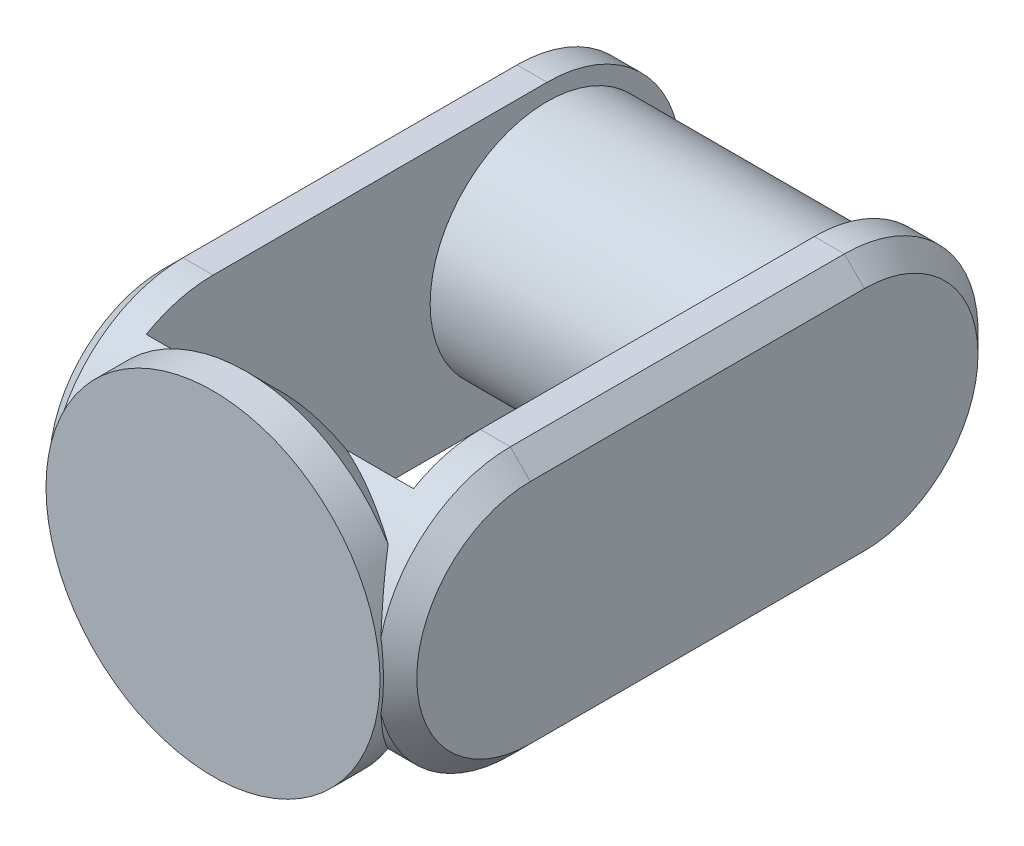
from build123d import *

# Parameters (mm, degrees)
SKETCH1_R           = 25
BOSS_EXTRUDE1_DEPTH = 10
BOSS_EXTRUDE3_DEPTH = 27.5
SKETCH7_W           = 40
SKETCH7_H           = 96.533506044
CUT_EXTRUDE3_DEPTH  = 55
CHAMFER1_SIZE       = 3
SKETCH8_R           = 17.5
BOSS_EXTRUDE4_DEPTH = 40
CHAMFER2_SIZE       = 5


with BuildPart() as part:
    # Sketch1 → Boss-Extrude1 (new body)
    with BuildSketch(Plane.XY):
        Circle(SKETCH1_R)
    extrude(amount=BOSS_EXTRUDE1_DEPTH)

    # Sketch6 → Boss-Extrude3 (add, symmetric)
    with BuildSketch(Plane(origin=(0, 0, 0), x_dir=(0, 0, -1), z_dir=(1, 0, 0))):
        with BuildLine():
            Line((10, 20), (60, 20))
            ThreePointArc((60, 20), (80, 0), (60, -20))
            Line((60, -20), (10, -20))
            ThreePointArc((10, -20), (-10, 0), (10, 20))
        make_face()
    extrude(amount=BOSS_EXTRUDE3_DEPTH, both=True)

    # Sketch7 → Cut-Extrude3 (cut)
    with BuildSketch(Plane(origin=(0, 20, 0), x_dir=(1, 0, 0), z_dir=(0, 1, 0))):
        with Locations((0, 48.266753022)):
            Rectangle(SKETCH7_W, SKETCH7_H)
    extrude(amount=-CUT_EXTRUDE3_DEPTH, mode=Mode.SUBTRACT)

    # Chamfer1
    # the kernel refuses this chamfer: 3 mm, written as the material it takes off along each edge
    with BuildSketch(Plane(origin=(-27.5, -20, -60), x_dir=(0.9996219169112965, -0.02749587661058676, 0), z_dir=(0, 0, 1)), Plane(origin=(27.5, -20, -60), x_dir=(0.027495876610586768, 0.9996219169112968, 0), z_dir=(0, 0, 1)), Plane(origin=(27.5, 20, -10), x_dir=(0.027495876610586768, -0.9996219169112968, 0), z_dir=(0, 0, -1))) as chamfer1_piece_1:
        Polygon((CHAMFER1_SIZE * 0.999621916911, CHAMFER1_SIZE * 0.0274958766106), (-CHAMFER1_SIZE * 0.0274958766106, CHAMFER1_SIZE * 0.999621916911), (0, 0), align=None)
    extrude(amount=50, mode=Mode.SUBTRACT)
    with BuildSketch(Plane(origin=(-27.5, 0, -60), x_dir=(0, 1, 0), z_dir=(0, 0, 1))) as chamfer1_piece_2:
        Polygon((20 - CHAMFER1_SIZE, 0), (20, -CHAMFER1_SIZE), (20, 0), align=None)
    revolve(axis=Axis((-27.5, 0, -60), (-1, 0, 0)), revolution_arc=180, mode=Mode.SUBTRACT)
    with BuildSketch(Plane(origin=(-27.5, 0, -10), x_dir=(0, -1, 0), z_dir=(0, 0, -1))) as chamfer1_piece_3_section:
        Polygon((20 - CHAMFER1_SIZE, 0), (20, -CHAMFER1_SIZE), (20, 0), align=None)
    chamfer1_piece_3 = revolve(axis=Axis((-27.5, 0, -10), (-1, 0, 0)), revolution_arc=180, mode=Mode.PRIVATE)
    chamfer1_piece_3 = chamfer1_piece_3 - Plane(origin=(0, 0, 8.545585815), x_dir=(1, 0, 0), z_dir=(0, 0, -1)) * Cylinder(25, 81, mode=Mode.PRIVATE)
    add(chamfer1_piece_3, mode=Mode.SUBTRACT)
    with BuildSketch(Plane(origin=(-27.5, 20, -10), x_dir=(-0.027495876610586768, -0.9996219169112968, 0), z_dir=(0, 0, -1))) as chamfer1_piece_4:
        Polygon((CHAMFER1_SIZE * 0.999621916911, -CHAMFER1_SIZE * 0.0274958766106), (-CHAMFER1_SIZE * 0.0274958766106, -CHAMFER1_SIZE * 0.999621916911), (0, 0), align=None)
    extrude(amount=50, mode=Mode.SUBTRACT)
    with BuildSketch(Plane(origin=(27.5, 0, -60), x_dir=(0, 1, 0), z_dir=(0, 0, 1))) as chamfer1_piece_5:
        Polygon((20, CHAMFER1_SIZE), (20 - CHAMFER1_SIZE, 0), (20, 0), align=None)
    revolve(axis=Axis((27.5, 0, -60), (-1, 0, 0)), revolution_arc=180, mode=Mode.SUBTRACT)
    with BuildSketch(Plane(origin=(27.5, 0, -10), x_dir=(0, -1, 0), z_dir=(0, 0, -1))) as chamfer1_piece_6_section:
        Polygon((20 - CHAMFER1_SIZE, 0), (20, CHAMFER1_SIZE), (20, 0), align=None)
    chamfer1_piece_6 = revolve(axis=Axis((27.5, 0, -10), (-1, 0, 0)), revolution_arc=180, mode=Mode.PRIVATE)
    chamfer1_piece_6 = chamfer1_piece_6 - Plane(origin=(0, 0, 8.545585813), x_dir=(1, 0, 0), z_dir=(0, 0, -1)) * Cylinder(25, 81, mode=Mode.PRIVATE)
    add(chamfer1_piece_6, mode=Mode.SUBTRACT)

    # Sketch8 → Boss-Extrude4 (add)
    with BuildSketch(Plane(origin=(-20, 0, 0), x_dir=(0, 0, -1), z_dir=(1, 0, 0))):
        with Locations(Location((60, 0, 0), (0, 0, 180))):
            Circle(SKETCH8_R)
    extrude(amount=BOSS_EXTRUDE4_DEPTH)

    # Chamfer2
    chamfer2_edges = [part.edges().sort_by_distance(p)[0] for p in [
        (0, 25, 0),
        (0, -25, 0),
    ]]
    chamfer(chamfer2_edges, length=CHAMFER2_SIZE)


solid = part.part
